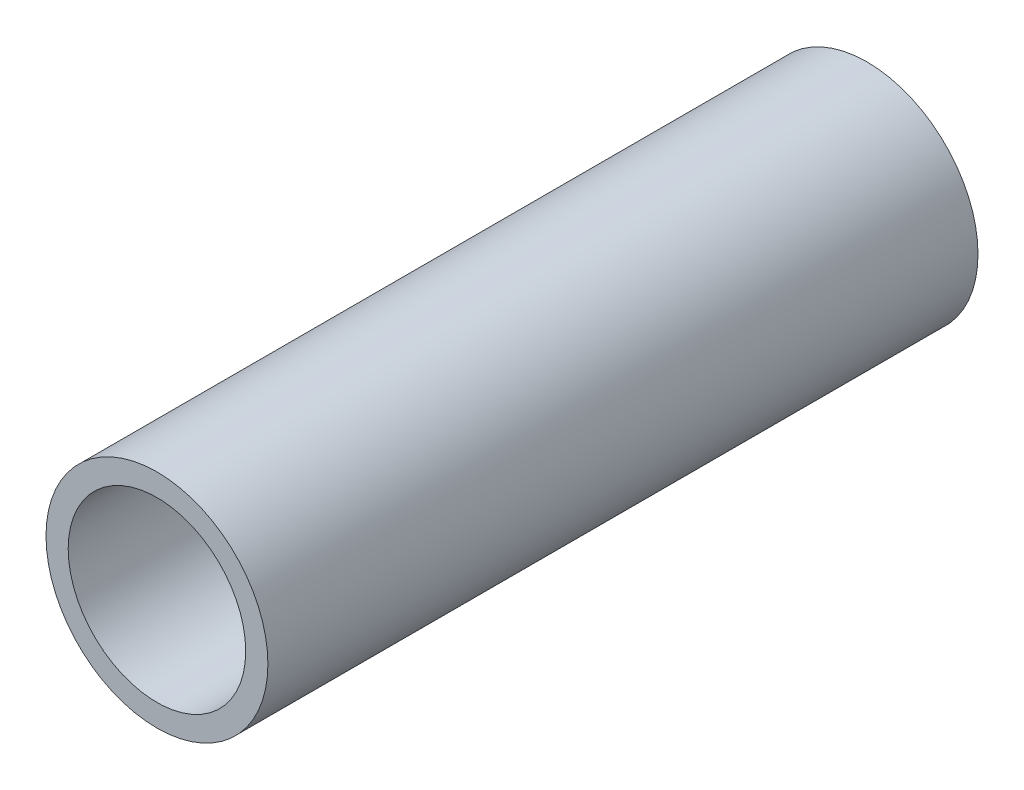
from build123d import *

# Parameters (mm, degrees)
SKETCH1_R           = 7.9375
SKETCH1_R_2         = 6.35
BOSS_EXTRUDE1_DEPTH = 25.4


with BuildPart() as part:
    # Sketch1 → Boss-Extrude1 (new, symmetric)
    with BuildSketch(Plane.XY):
        Circle(SKETCH1_R)
        Circle(SKETCH1_R_2, mode=Mode.SUBTRACT)
    extrude(amount=BOSS_EXTRUDE1_DEPTH, both=True)


solid = part.part
